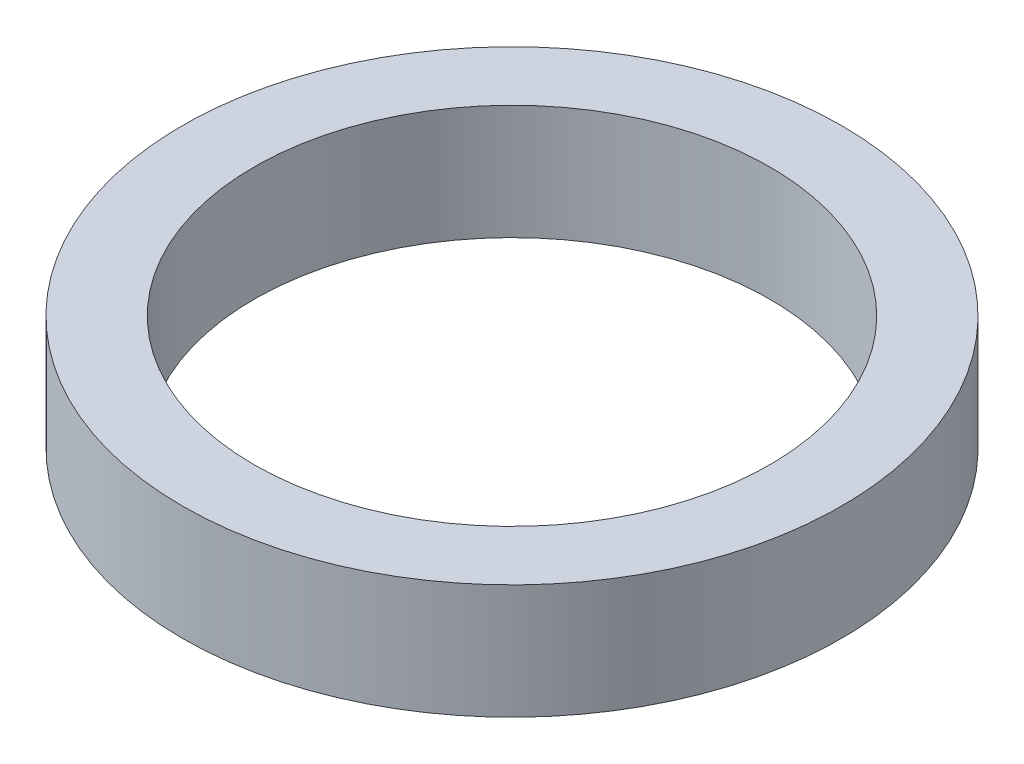
from build123d import *

# Parameters (mm, degrees)
SKETCH1_R           = 57.5
BOSS_EXTRUDE1_DEPTH = 20
SKETCH2_R           = 45
CUT_EXTRUDE1_DEPTH  = 84.740671122


with BuildPart() as part:
    # Sketch1 → Boss-Extrude1 (new body)
    with BuildSketch(Plane(origin=(0, 0, 0), x_dir=(1, 0, 0), z_dir=(0, 1, 0))):
        Circle(SKETCH1_R)
    extrude(amount=BOSS_EXTRUDE1_DEPTH)

    # Sketch2 → Cut-Extrude1 (cut, through all)
    with BuildSketch(Plane(origin=(0, 0, 0), x_dir=(1, 0, 0), z_dir=(0, 1, 0))):
        Circle(SKETCH2_R)
    extrude(amount=CUT_EXTRUDE1_DEPTH, mode=Mode.SUBTRACT)


solid = part.part
